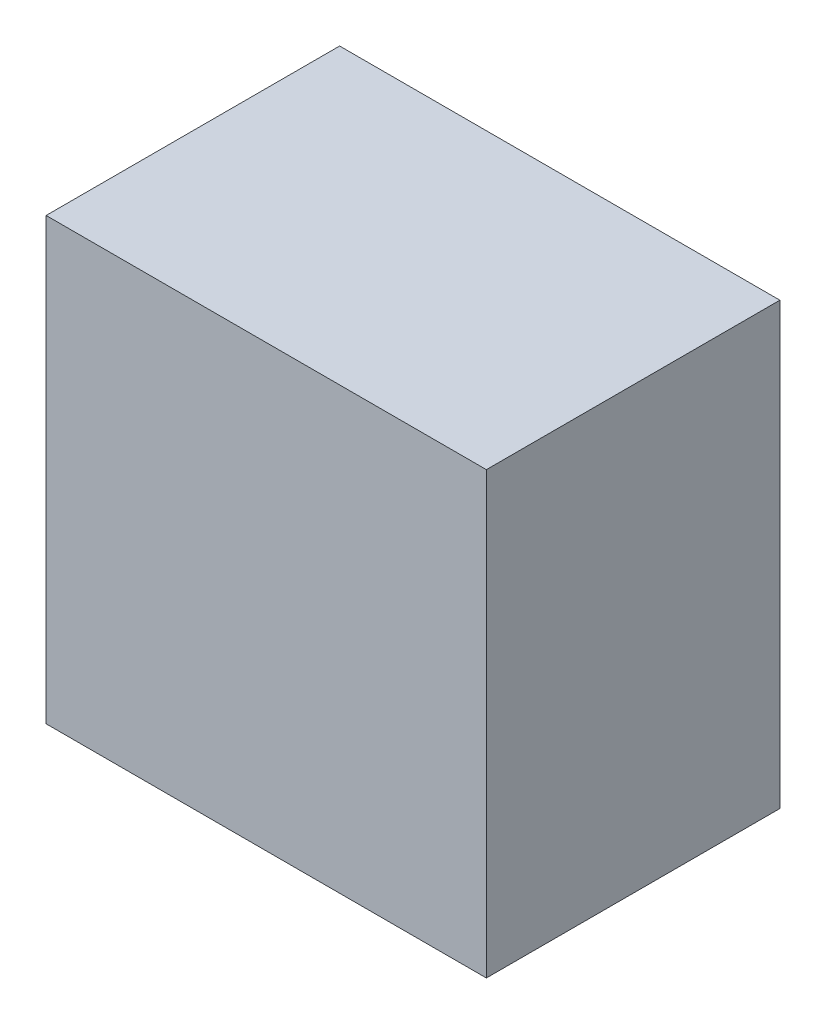
from build123d import *

# Parameters (mm, degrees)
SKETCH1_R           = 50
BOSS_EXTRUDE1_DEPTH = 25
SKETCH2_W           = 120
SKETCH2_H           = 120
SKETCH2_R           = 55
BOSS_EXTRUDE2_DEPTH = 30
SKETCH3_W           = 120
SKETCH3_H           = 120
BOSS_EXTRUDE3_DEPTH = 10


with BuildPart() as part:
    # Sketch1 → Boss-Extrude1 (new, symmetric)
    with BuildSketch(Plane.XY):
        Circle(SKETCH1_R)
    extrude(amount=BOSS_EXTRUDE1_DEPTH, both=True)


with BuildPart() as body_2:
    # Sketch2 → Boss-Extrude2 (new, symmetric)
    with BuildSketch(Plane.XY):
        Rectangle(SKETCH2_W, SKETCH2_H)
        Circle(SKETCH2_R, mode=Mode.SUBTRACT)
    extrude(amount=BOSS_EXTRUDE2_DEPTH, both=True)

    # Sketch3 → Boss-Extrude3 (add)
    with BuildSketch(Plane.XY.offset(30)):
        Rectangle(SKETCH3_W, SKETCH3_H)
    boss_extrude3 = extrude(amount=BOSS_EXTRUDE3_DEPTH)

    # Mirror1: Boss-Extrude3 across plane
    add(boss_extrude3.mirror(Plane.XY))


solid = Compound([part.part, body_2.part])
